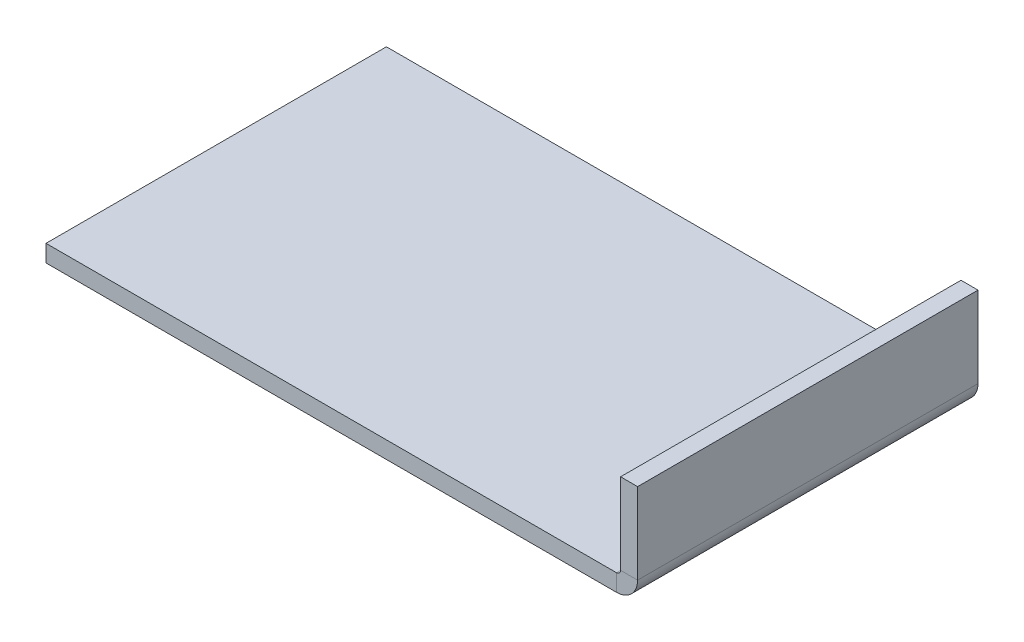
from build123d import *

# Parameters (mm, degrees)
SKETCH1_W           = 106.426
SKETCH1_H           = 63.5
BOSS_EXTRUDE1_DEPTH = 3.175
EDGE_FLANGE1_DEPTH  = 63.5


# Sheet-metal steps are written as plain solids
with BuildPart() as part:
    # Sketch1 → Boss-Extrude1 (new body)
    with BuildSketch(Plane(origin=(0, 0, 0), x_dir=(1, 0, 0), z_dir=(0, 1, 0))):
        with Locations((53.213, 31.75)):
            Rectangle(SKETCH1_W, SKETCH1_H)
    extrude(amount=BOSS_EXTRUDE1_DEPTH)

    # Edge-Flange1 section (across the edge) → Edge-Flange1 (add)
    with BuildSketch(Plane(origin=(107.188, 3.175, 0), x_dir=(-1, 0, 0), z_dir=(0, 0, -1))):
        with BuildLine():
            Line((-3.175, 0.762), (-3.175, 15.875))
            Line((-3.175, 15.875), (0, 15.875))
            Line((0, 15.875), (0, 0.762))
            ThreePointArc((0, 0.762), (0.223184633, 0.223184633), (0.762, 0))
            Line((0.762, 0), (0.762, -3.175))
            ThreePointArc((0.762, -3.175), (-2.021879398, -2.021879398), (-3.175, 0.762))
        make_face()
    extrude(amount=EDGE_FLANGE1_DEPTH)


solid = part.part
